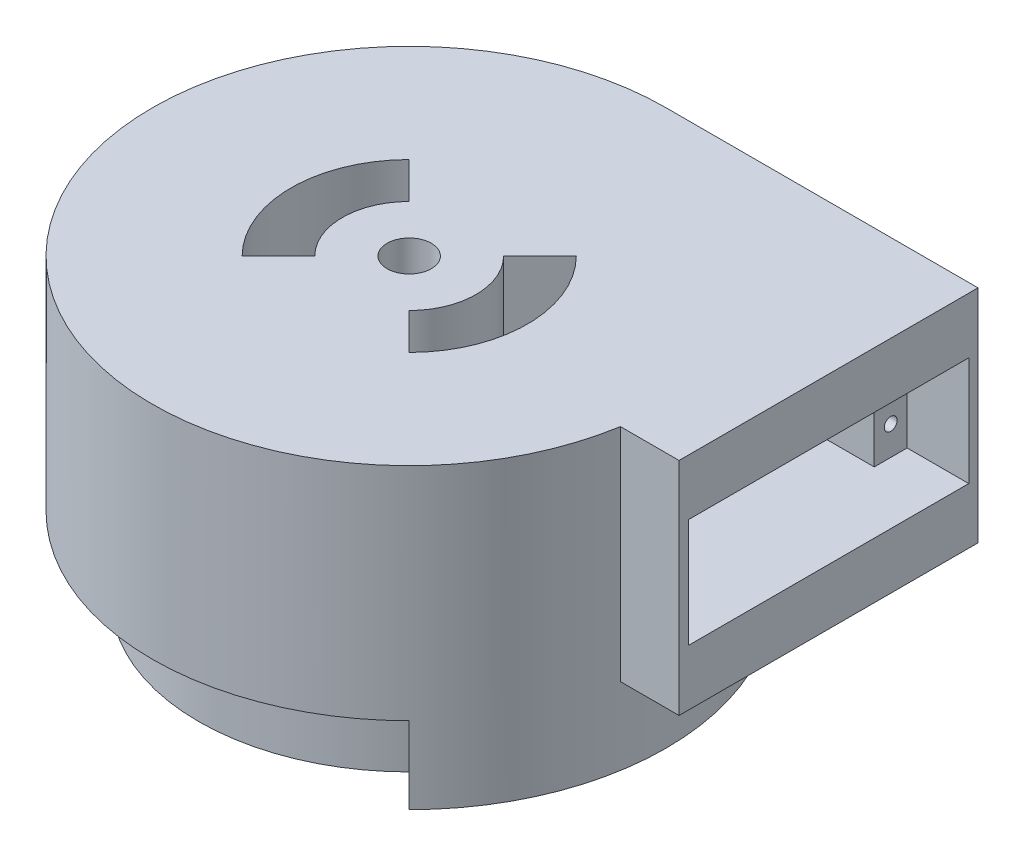
from build123d import *

# Parameters (mm, degrees)
BOSS_EXTRUDE1_DEPTH     = 43
BOSS_EXTRUDE2_START     = 15
BOSS_EXTRUDE2_DEPTH     = 15
SKETCH5_W               = 41.8
SKETCH5_H               = 21.2
CUT_EXTRUDE1_DEPTH      = 40
SKETCH5_5_W             = 6.4
SKETCH5_5_H             = 21.2
SKETCH5_5_R             = 1.25
CUT_EXTRUDE2_DEPTH      = 12
SKETCH5_6_R             = 1.25
CUT_EXTRUDE3_DEPTH      = 50
CUT_EXTRUDE4_DEPTH      = 98.740048166
CUT_EXTRUDE4_DEPTH_BACK = 98.740048166
SKETCH6_R               = 4.3
CUT_EXTRUDE5_START      = -5
SKETCH7_W               = 10
SKETCH7_H               = 6.8
CUT_EXTRUDE5_DEPTH      = 114.735895012


with BuildPart() as part:
    # Sketch1 → Boss-Extrude1 (new body)
    with BuildSketch(Plane(origin=(0, 0, 0), x_dir=(1, 0, 0), z_dir=(0, 1, 0))):
        with BuildLine():
            Line((0, 50), (60.738101844, 50))
            Line((60.738101844, 50), (60.738101844, -8.2))
            Line((60.738101844, -8.2), (49.323016939, -8.2))
            ThreePointArc((49.323016939, -8.2), (-38.144462246, -32.32645975), (0, 50))
        make_face()
    extrude(amount=BOSS_EXTRUDE1_DEPTH)

    # Sketch4 → Boss-Extrude2 (add)
    with BuildSketch(Plane.XZ.offset(BOSS_EXTRUDE2_START)):
        with BuildLine():
            Line((28.991378029, 28.991378029), (35.355339059, 35.355339059))
            ThreePointArc((35.355339059, 35.355339059), (50, 0), (35.355339059, -35.355339059))
            Line((35.355339059, -35.355339059), (28.991378029, -28.991378029))
            ThreePointArc((28.991378029, -28.991378029), (-41, 0), (28.991378029, 28.991378029))
        make_face()
    extrude(amount=-BOSS_EXTRUDE2_DEPTH)

    # Sketch5 → Cut-Extrude1 (cut)
    with BuildSketch(Plane(origin=(60.738101844, 0, 0), x_dir=(0, 0, -1), z_dir=(1, 0, 0))):
        with Locations((20.9, 21.5)):
            Rectangle(SKETCH5_W, SKETCH5_H)
    extrude(amount=-CUT_EXTRUDE1_DEPTH, mode=Mode.SUBTRACT)

    # Sketch5<5> → Cut-Extrude2 (cut)
    # profile 1 of 2: a face of its own
    with BuildSketch(Plane(origin=(60.738101844, 0, 0), x_dir=(0, 0, -1), z_dir=(1, 0, 0))):
        with Locations((-3.2, 21.5)):
            Rectangle(SKETCH5_5_W, SKETCH5_5_H)
        with Locations((-3.2, 16.55)):
            Circle(SKETCH5_5_R, mode=Mode.SUBTRACT)
        with Locations((-3.2, 26.45)):
            Circle(SKETCH5_5_R, mode=Mode.SUBTRACT)
    # profile 2 of 2: a face of its own
    with BuildSketch(Plane(origin=(60.738101844, 0, 0), x_dir=(0, 0, -1), z_dir=(1, 0, 0))):
        with Locations((45, 21.5)):
            Rectangle(SKETCH5_5_W, SKETCH5_5_H)
        with Locations((45, 16.55)):
            Circle(SKETCH5_5_R, mode=Mode.SUBTRACT)
        with Locations((45, 26.45)):
            Circle(SKETCH5_5_R, mode=Mode.SUBTRACT)
    extrude(amount=-CUT_EXTRUDE2_DEPTH, mode=Mode.SUBTRACT)

    # Sketch5<6> → Cut-Extrude3 (cut)
    with BuildSketch(Plane(origin=(60.738101844, 0, 0), x_dir=(0, 0, -1), z_dir=(1, 0, 0))):
        with Locations((-3.2, 26.45)):
            Circle(SKETCH5_6_R)
        with Locations((-3.2, 16.55)):
            Circle(SKETCH5_6_R)
        with Locations((45, 16.55)):
            Circle(SKETCH5_6_R)
        with Locations((45, 26.45)):
            Circle(SKETCH5_6_R)
    extrude(amount=-CUT_EXTRUDE3_DEPTH, mode=Mode.SUBTRACT)

    # Sketch6 → Cut-Extrude4 (cut, two sides: drawn at the far end of the back side and taken through both)
    with BuildSketch(Plane.XZ.offset(15).offset(-CUT_EXTRUDE4_DEPTH_BACK)):
        Circle(SKETCH6_R)
        with BuildLine():
            Line((9.192388155, 9.192388155), (16.263455967, 16.263455967))
            ThreePointArc((16.263455967, 16.263455967), (23, 0), (16.263455967, -16.263455967))
            Line((16.263455967, -16.263455967), (9.192388155, -9.192388155))
            ThreePointArc((9.192388155, -9.192388155), (13, 0), (9.192388155, 9.192388155))
        make_face()
        with BuildLine():
            Line((-9.192388155, -9.192388155), (-16.263455967, -16.263455967))
            ThreePointArc((-16.263455967, -16.263455967), (-23, 0), (-16.263455967, 16.263455967))
            Line((-16.263455967, 16.263455967), (-9.192388155, 9.192388155))
            ThreePointArc((-9.192388155, 9.192388155), (-13, 0), (-9.192388155, -9.192388155))
        make_face()
    extrude(amount=CUT_EXTRUDE4_DEPTH + CUT_EXTRUDE4_DEPTH_BACK, mode=Mode.SUBTRACT)

    # Sketch7 → Cut-Extrude5 (cut, through all)
    with BuildSketch(Plane(origin=(48.738101844, 0, 0), x_dir=(0, 0, -1), z_dir=(1, 0, 0)).offset(CUT_EXTRUDE5_START)):
        with Locations((41.8, 21.5)):
            Rectangle(SKETCH7_W, SKETCH7_H)
    extrude(amount=-CUT_EXTRUDE5_DEPTH, mode=Mode.SUBTRACT)


solid = part.part
